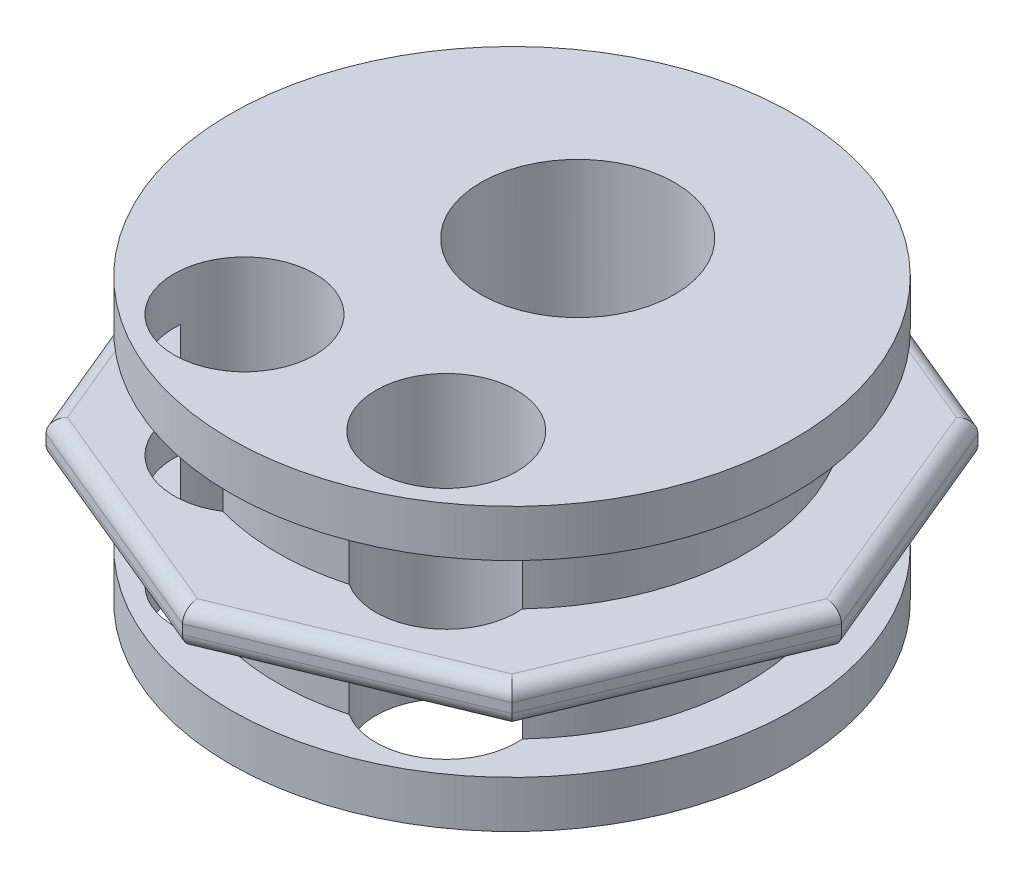
from build123d import *

# Parameters (mm, degrees)
BOSS_EXTRUDE1_DEPTH  = 2
SKETCH12_R           = 25
BOSS_EXTRUDE2_DEPTH  = 8
CUT_EXTRUDE6_START   = -36
SKETCH17_R           = 10.33
CUT_EXTRUDE6_DEPTH   = 45.856111051
SKETCH25_R           = 30
BOSS_EXTRUDE3_DEPTH  = 5
CUT_EXTRUDE9_START   = -53
SKETCH26_R           = 10.33
CUT_EXTRUDE9_DEPTH   = 53
FILLET3_R            = 1.5
SKETCH23_R           = 7.5
CUT_EXTRUDE11_DEPTH  = 36
FILLET3_OF_MIRROR1_R = 1.5
CUT_EXTRUDE12_START  = -10
SKETCH28_R           = 10.33
CUT_EXTRUDE12_DEPTH  = 10


with BuildPart() as part:
    # Sketch3 → Boss-Extrude1 (new body)
    with BuildSketch(Plane(origin=(0, 0, 0), x_dir=(1, 0, 0), z_dir=(0, 1, 0))):
        Polygon((35.1, 0), (24.81944802, 24.81944802), (0, 35.1), (-24.81944802, 24.81944802), (-35.1, 0), (-24.81944802, -24.81944802), (0, -35.1), (24.81944802, -24.81944802), align=None)
    boss_extrude1 = extrude(amount=BOSS_EXTRUDE1_DEPTH)

    # Sketch12 → Boss-Extrude2 (add)
    with BuildSketch(Plane(origin=(0, 2, 0), x_dir=(1, 0, 0), z_dir=(0, 1, 0))):
        Circle(SKETCH12_R)
    boss_extrude2 = extrude(amount=BOSS_EXTRUDE2_DEPTH)

    # Sketch17 → Cut-Extrude6 (cut)
    with BuildSketch(Plane(origin=(0, 10, 0), x_dir=(1, 0, 0), z_dir=(0, 1, 0)).offset(CUT_EXTRUDE6_START)):
        with Locations((0, 7)):
            Circle(SKETCH17_R)
    cut_extrude6 = extrude(amount=CUT_EXTRUDE6_DEPTH, mode=Mode.SUBTRACT)

    # Sketch25 → Boss-Extrude3 (add)
    with BuildSketch(Plane(origin=(0, 10, 0), x_dir=(1, 0, 0), z_dir=(0, 1, 0))):
        Circle(SKETCH25_R)
    boss_extrude3 = extrude(amount=BOSS_EXTRUDE3_DEPTH)

    # Sketch26 → Cut-Extrude9 (cut)
    with BuildSketch(Plane(origin=(0, 15, 0), x_dir=(1, 0, 0), z_dir=(0, 1, 0)).offset(CUT_EXTRUDE9_START)):
        with Locations((0, 7)):
            Circle(SKETCH26_R)
    extrude(amount=CUT_EXTRUDE9_DEPTH, mode=Mode.SUBTRACT)

    # Fillet3
    fillet3_edges = [part.edges().sort_by_distance(p)[0] for p in [
        (12.40972401, 2, 29.95972401),
        (29.95972401, 2, 12.40972401),
        (-12.40972401, 2, 29.95972401),
        (-29.95972401, 2, 12.40972401),
        (-29.95972401, 2, -12.40972401),
        (29.95972401, 2, -12.40972401),
        (-12.40972401, 2, -29.95972401),
        (12.40972401, 2, -29.95972401),
    ]]
    fillet(fillet3_edges, radius=FILLET3_R)

    # Sketch23 → Cut-Extrude11 (cut, symmetric)
    with BuildSketch(Plane(origin=(0, 10, 0), x_dir=(1, 0, 0), z_dir=(0, 1, 0))):
        with Locations((-10.75, -17.75)):
            Circle(SKETCH23_R)
        with Locations((10.75, -17.75)):
            Circle(SKETCH23_R)
    cut_extrude11 = extrude(amount=CUT_EXTRUDE11_DEPTH, both=True, mode=Mode.SUBTRACT)

    # Mirror1: Boss-Extrude1, Boss-Extrude2, Cut-Extrude6, Boss-Extrude3, Cut-Extrude11 across plane
    add(boss_extrude1.mirror(Plane.ZX))
    add(boss_extrude2.mirror(Plane.ZX))
    add(cut_extrude6.mirror(Plane.ZX), mode=Mode.SUBTRACT)
    add(boss_extrude3.mirror(Plane.ZX))
    add(cut_extrude11.mirror(Plane.ZX), mode=Mode.SUBTRACT)

    # Fillet3 of Mirror1
    fillet3_of_mirror1_edges = [part.edges().sort_by_distance(p)[0] for p in [
        (12.40972401, -2, 29.95972401),
        (29.95972401, -2, 12.40972401),
        (-12.40972401, -2, 29.95972401),
        (-29.95972401, -2, 12.40972401),
        (-29.95972401, -2, -12.40972401),
        (29.95972401, -2, -12.40972401),
        (-12.40972401, -2, -29.95972401),
        (12.40972401, -2, -29.95972401),
    ]]
    fillet(fillet3_of_mirror1_edges, radius=FILLET3_OF_MIRROR1_R)

    # Sketch28 → Cut-Extrude12 (cut)
    with BuildSketch(Plane.XZ.offset(15).offset(CUT_EXTRUDE12_START)):
        with Locations((0, -7)):
            Circle(SKETCH28_R)
    extrude(amount=CUT_EXTRUDE12_DEPTH, mode=Mode.SUBTRACT)


solid = part.part
